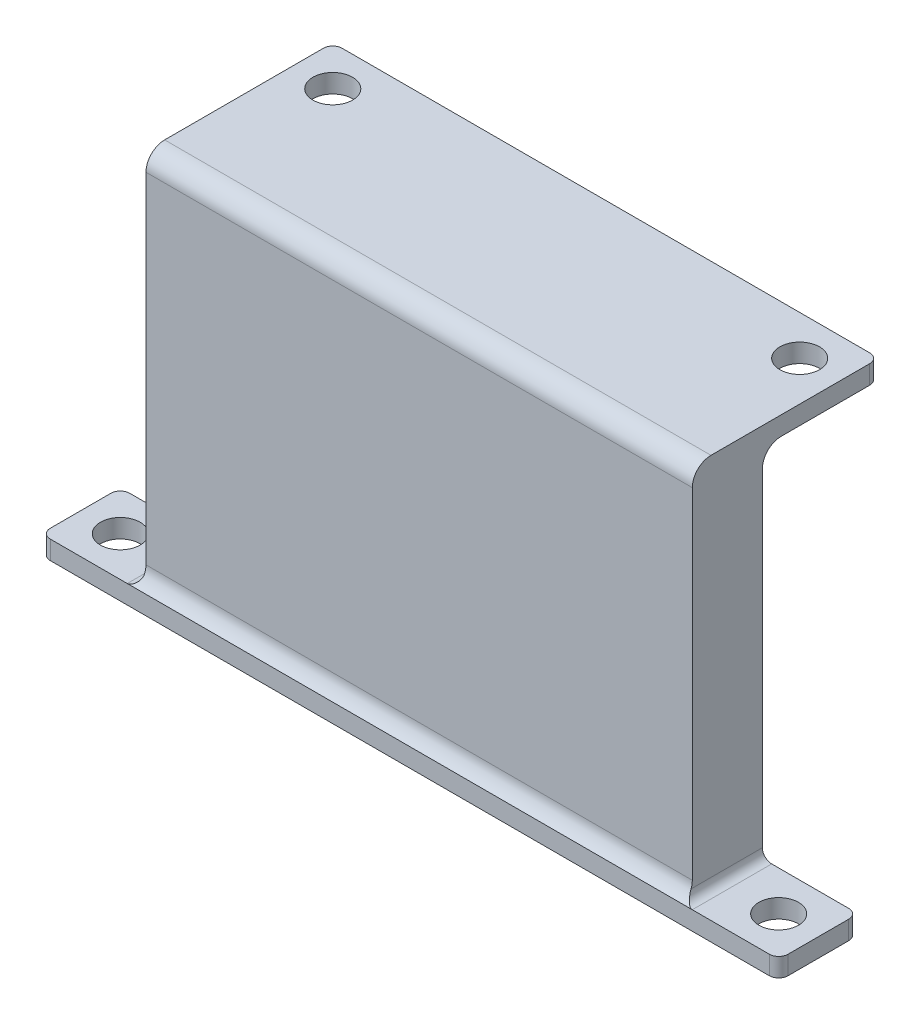
from build123d import *

# Parameters (mm, degrees)
SKETCH1_W           = 79
SKETCH1_H           = 8.5
SKETCH1_R           = 2.125
BOSS_EXTRUDE1_DEPTH = 2
SKETCH3_W           = 58.5
SKETCH3_H           = 7.5
BOSS_EXTRUDE2_DEPTH = 40.14
SKETCH4_W           = 58.5
SKETCH4_H           = 2
BOSS_EXTRUDE3_DEPTH = 12.5
CUT_EXTRUDE1_REACH  = 93.966
SKETCH5_R           = 2.125
FILLET1_R           = 2
FILLET2_R           = 1
FILLET3_R           = 2
FILLET4_R           = 1
FILLET5_R           = 1


with BuildPart() as part:
    # Sketch1 → Boss-Extrude1 (new body)
    with BuildSketch(Plane(origin=(0, 0, 0), x_dir=(1, 0, 0), z_dir=(0, 1, 0))):
        with Locations((-39.5, 4.25)):
            Rectangle(SKETCH1_W, SKETCH1_H)
        with Locations(Location((-74.75, 4.25, 0), (0, 0, 270))):
            Circle(SKETCH1_R, mode=Mode.SUBTRACT)
        with Locations(Location((-4.25, 4.25, 0), (0, 0, 270))):
            Circle(SKETCH1_R, mode=Mode.SUBTRACT)
    extrude(amount=BOSS_EXTRUDE1_DEPTH)

    # Sketch3 → Boss-Extrude2 (add)
    with BuildSketch(Plane(origin=(0, 2, 0), x_dir=(1, 0, 0), z_dir=(0, 1, 0))):
        with Locations((-39.5, 4.75)):
            Rectangle(SKETCH3_W, SKETCH3_H)
    extrude(amount=BOSS_EXTRUDE2_DEPTH)

    # Sketch4 → Boss-Extrude3 (add)
    with BuildSketch(Plane(origin=(0, 0, -8.5), x_dir=(-1, 0, 0), z_dir=(0, 0, -1))):
        with Locations((39.5, 41.14)):
            Rectangle(SKETCH4_W, SKETCH4_H)
    extrude(amount=BOSS_EXTRUDE3_DEPTH)

    # Sketch5 → Cut-Extrude1 (cut, up to next)
    with BuildSketch(Plane(origin=(0, 42.14, 0), x_dir=(1, 0, 0), z_dir=(0, 1, 0)), mode=Mode.PRIVATE) as cut_extrude1_sk1:
        with Locations(Location((-14.5, 16.75, 0), (0, 0, 270))):
            Circle(SKETCH5_R)
    cut_extrude1_tool1 = extrude(cut_extrude1_sk1.sketch, amount=-CUT_EXTRUDE1_REACH, mode=Mode.PRIVATE) & part.part
    # Sketch5 → Cut-Extrude1 (cut, up to next)
    with BuildSketch(Plane(origin=(0, 42.14, 0), x_dir=(1, 0, 0), z_dir=(0, 1, 0)), mode=Mode.PRIVATE) as cut_extrude1_sk2:
        with Locations(Location((-64.5, 16.75, 0), (0, 0, 270))):
            Circle(SKETCH5_R)
    cut_extrude1_tool2 = extrude(cut_extrude1_sk2.sketch, amount=-CUT_EXTRUDE1_REACH, mode=Mode.PRIVATE) & part.part
    add(cut_extrude1_tool1.solids().sort_by_distance((-14.5, 42.14, -16.75))[0], mode=Mode.SUBTRACT)
    add(cut_extrude1_tool2.solids().sort_by_distance((-64.5, 42.14, -16.75))[0], mode=Mode.SUBTRACT)

    # Fillet1
    # the kernel refuses this fillet: 2 mm, written as the material it adds along each edge
    with BuildSketch(Plane(origin=(-68.75, 40.14, -8.5), x_dir=(0, -1, 0), z_dir=(1, 0, 0))) as fillet1_piece_1:
        with BuildLine():
            CenterArc((FILLET1_R, FILLET1_R), FILLET1_R, 180, 90)
            Line((0, FILLET1_R), (-FILLET1_R * 0.02, FILLET1_R))
            Line((-FILLET1_R * 0.02, FILLET1_R), (-FILLET1_R * 0.02, -FILLET1_R * 0.02))
            Line((-FILLET1_R * 0.02, -FILLET1_R * 0.02), (FILLET1_R, -FILLET1_R * 0.02))
            Line((FILLET1_R, -FILLET1_R * 0.02), (FILLET1_R, 0))
        make_face()
    extrude(amount=58.5)
    with BuildSketch(Plane(origin=(-68.75, 2, -1), x_dir=(0, 0, 1), z_dir=(1, 0, 0))) as fillet1_piece_2:
        with BuildLine():
            CenterArc((2, -1.732050808), FILLET1_R, 120, 60)
            Line((0, -1.732050808), (-0.04, -1.732050808))
            Line((-0.04, -1.732050808), (-0.04, 0))
            Line((-0.04, 0), (0, 0.04))
            ThreePointArc((0, 0.04), (0.5, 0.04), (0.98, 0.034641016))
            Line((0.98, 0.034641016), (1, 0))
        make_face()
    extrude(amount=58.5)

    # Fillet2
    fillet2_edges = [part.edges().sort_by_distance(p)[0] for p in [
        (-79, 1, 0),
        (-79, 1, -8.5),
        (-68.75, 41.14, -21),
        (-10.25, 41.14, -21),
        (0, 1, -8.5),
        (0, 1, 0),
    ]]
    fillet(fillet2_edges, radius=FILLET2_R)

    # Fillet3
    fillet3_edges = [part.edges().sort_by_distance(p)[0] for p in [
        (-39.5, 42.14, -1),
    ]]
    fillet(fillet3_edges, radius=FILLET3_R)

    # Fillet4
    # the kernel refuses this fillet: 1 mm, written as the material it adds along each edge
    with BuildSketch(Plane(origin=(-10.25, 2, 0), x_dir=(0, 1, 0), z_dir=(0, 0, -1))) as fillet4_piece_1_section:
        with BuildLine():
            CenterArc((FILLET4_R, FILLET4_R), FILLET4_R, 180, 90)
            Line((0, FILLET4_R), (0, 0))
            Line((0, 0), (FILLET4_R, 0))
        make_face()
    fillet4_piece_1 = extrude(amount=8.5, mode=Mode.PRIVATE)
    fillet4_piece_1 = fillet4_piece_1 - Plane(origin=(-10.019982346, 3.732050808, 1), x_dir=(0, 0, 1), z_dir=(-1, 0, 0)) * Cylinder(2, 21, mode=Mode.PRIVATE)
    add(fillet4_piece_1)

    # Fillet5
    # the kernel refuses this fillet: 1 mm, written as the material it adds along each edge
    with BuildSketch(Plane(origin=(-68.75, 2, -8.5), x_dir=(-1, 0, 0), z_dir=(0, 0, 1))) as fillet5_piece_1_section:
        with BuildLine():
            CenterArc((FILLET5_R, -FILLET5_R), FILLET5_R, 90, 90)
            Line((0, -FILLET5_R), (0, 0))
            Line((0, 0), (FILLET5_R, 0))
        make_face()
    fillet5_piece_1 = extrude(amount=8.5, mode=Mode.PRIVATE)
    fillet5_piece_1 = fillet5_piece_1 - Plane(origin=(-68.980019627, 3.732050808, 1), x_dir=(0, 0, 1), z_dir=(-1, 0, 0)) * Cylinder(2, 21, mode=Mode.PRIVATE)
    add(fillet5_piece_1)


solid = part.part
